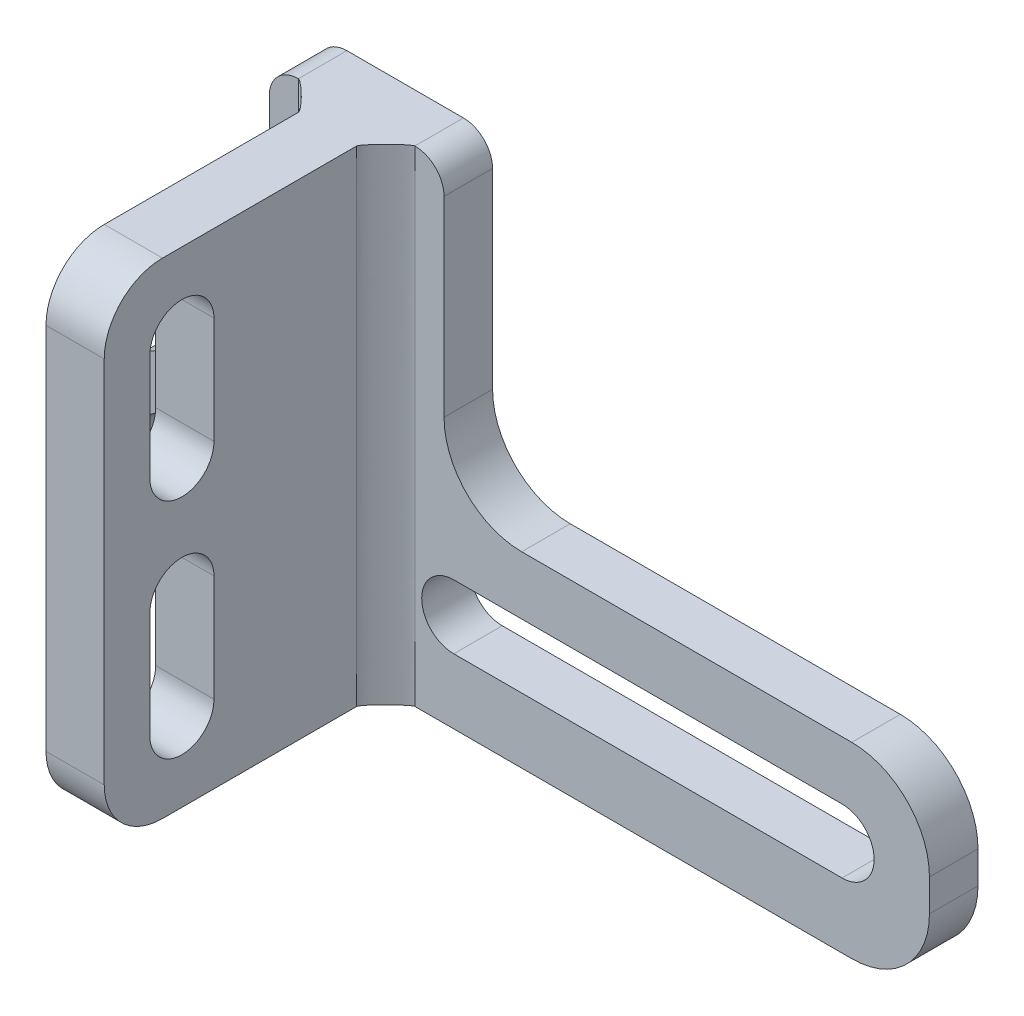
from build123d import *

# Parameters (mm, degrees)
SKETCH_1_W          = 42
SKETCH_1_H          = 40
EXTRUDE_1_DEPTH     = 2.5
SKETCH_2_W          = 3
SKETCH_2_H          = 25
EXTRUDE_2_DEPTH     = 14.5
CUT_EXTRUDE_2_DEPTH = 33.422985674
CUT_EXTRUDE_3_DEPTH = 39.379682125
SKETCH_6_W          = 42
SKETCH_6_H          = 15
CUT_EXTRUDE_4_DEPTH = 33.422985674
CUT_EXTRUDE_5_DEPTH = 33.422985674
FILLET_2_R          = 3
FILLET_3_SIZE       = 1.5
FILLET_4_R          = 1.5
FILLET_5_R          = 4


# Some blends are built 0.0001 mm under size
with BuildPart() as part:
    # 草图1 → 凸台-拉伸1 (new body)
    with BuildSketch(Plane.XY):
        Rectangle(SKETCH_1_W, SKETCH_1_H)
    extrude(amount=EXTRUDE_1_DEPTH)

    # 草图2 → 凸台-拉伸2 (add)
    with BuildSketch(Plane.XY.offset(2.5)):
        with Locations((-8.5, 7.5)):
            Rectangle(SKETCH_2_W, SKETCH_2_H)
    extrude(amount=EXTRUDE_2_DEPTH)

    # 草图5 → 切除-拉伸2 (cut, through all)
    with BuildSketch(Plane.XY.offset(2.5)):
        with BuildLine():
            Line((-18, 1.65), (-13.5, 1.65))
            ThreePointArc((-13.5, 1.65), (-11.85, 0), (-13.5, -1.65))
            Line((-13.5, -1.65), (-18, -1.65))
            ThreePointArc((-18, -1.65), (-19.65, 0), (-18, 1.65))
        make_face()
        with BuildLine():
            Line((-3.5, 1.65), (16.5, 1.65))
            ThreePointArc((16.5, 1.65), (18.15, 0), (16.5, -1.65))
            Line((16.5, -1.65), (-3.5, -1.65))
            ThreePointArc((-3.5, -1.65), (-5.15, 0), (-3.5, 1.65))
        make_face()
    extrude(amount=-CUT_EXTRUDE_2_DEPTH, mode=Mode.SUBTRACT)

    # 草图4 → 切除-拉伸3 (cut, through all)
    with BuildSketch(Plane(origin=(-7, 0, 0), x_dir=(0, 0, -1), z_dir=(1, 0, 0))):
        with BuildLine():
            Line((-11.35, 16), (-11.35, 10.5))
            ThreePointArc((-11.35, 10.5), (-13, 8.85), (-14.65, 10.5))
            Line((-14.65, 10.5), (-14.65, 16))
            ThreePointArc((-14.65, 16), (-13, 17.65), (-11.35, 16))
        make_face()
        with BuildLine():
            Line((-11.35, -1), (-11.35, 4.5))
            ThreePointArc((-11.35, 4.5), (-13, 6.15), (-14.65, 4.5))
            Line((-14.65, 4.5), (-14.65, -1))
            ThreePointArc((-14.65, -1), (-13, -2.65), (-11.35, -1))
        make_face()
    extrude(amount=-CUT_EXTRUDE_3_DEPTH, mode=Mode.SUBTRACT)

    # 草图6 → 切除-拉伸4 (cut, through all)
    with BuildSketch(Plane.XY.offset(2.5)):
        with Locations((0, -12.5)):
            Rectangle(SKETCH_6_W, SKETCH_6_H)
    extrude(amount=-CUT_EXTRUDE_4_DEPTH, mode=Mode.SUBTRACT)

    # 草图7 → 切除-拉伸5 (cut, through all)
    with BuildSketch(Plane.XY.offset(2.5)):
        with BuildLine():
            Line((-21, 20), (-13, 20))
            Line((-13, 20), (-13, 8.65))
            ThreePointArc((-13, 8.65), (-14.171572875, 5.821572875), (-17, 4.65))
            Line((-17, 4.65), (-21, 4.65))
            Line((-21, 4.65), (-21, 20))
        make_face()
        with BuildLine():
            Line((21, 20), (-4, 20))
            Line((-4, 20), (-4, 8.65))
            ThreePointArc((-4, 8.65), (-2.828427125, 5.821572875), (0, 4.65))
            Line((0, 4.65), (21, 4.65))
            Line((21, 4.65), (21, 20))
        make_face()
    extrude(amount=-CUT_EXTRUDE_5_DEPTH, mode=Mode.SUBTRACT)

    # 圆角2
    fillet_2_edges = [part.edges().sort_by_distance(p)[0] for p in [
        (-8.5, 20, 17),
        (-8.5, -5, 17),
    ]]
    fillet(fillet_2_edges, radius=FILLET_2_R)

    # 圆角3
    # a fillet whose section is not a circle: 1.5 mm, written as the material it adds along each edge
    with BuildSketch(Plane(origin=(-10, 20, 2.5), x_dir=(0, 0, 1), z_dir=(0, -1, 0)), Plane(origin=(-7, -5, 2.5), x_dir=(0, 0, 1), z_dir=(0, 1, 0))) as fillet_3_piece_1:
        with BuildLine():
            Bezier((FILLET_3_SIZE, 0), (0, 0), (0, FILLET_3_SIZE), weights=[1, 0.111111111, 1])
            Line((0, FILLET_3_SIZE), (0, 0))
            Line((0, 0), (FILLET_3_SIZE, 0))
        make_face()
    extrude(amount=25)

    # 圆角4
    fillet_4_edges = [part.edges().sort_by_distance(p)[0] for p in [
        (-4, 20, 1.25),
        (-13, 20, 1.25),
    ]]
    fillet(fillet_4_edges, radius=FILLET_4_R)

    # 圆角5
    fillet_5_edges = [part.edges().sort_by_distance(p)[0] for p in [
        (-21, -5, 1.25),
        (-21, 4.65, 1.25),
        (21, -5, 1.25),
        (21, 4.65, 1.25),
    ]]
    fillet(fillet_5_edges, radius=FILLET_5_R - 0.0001)  # a hair under: the kernel refuses the full size


solid = part.part
